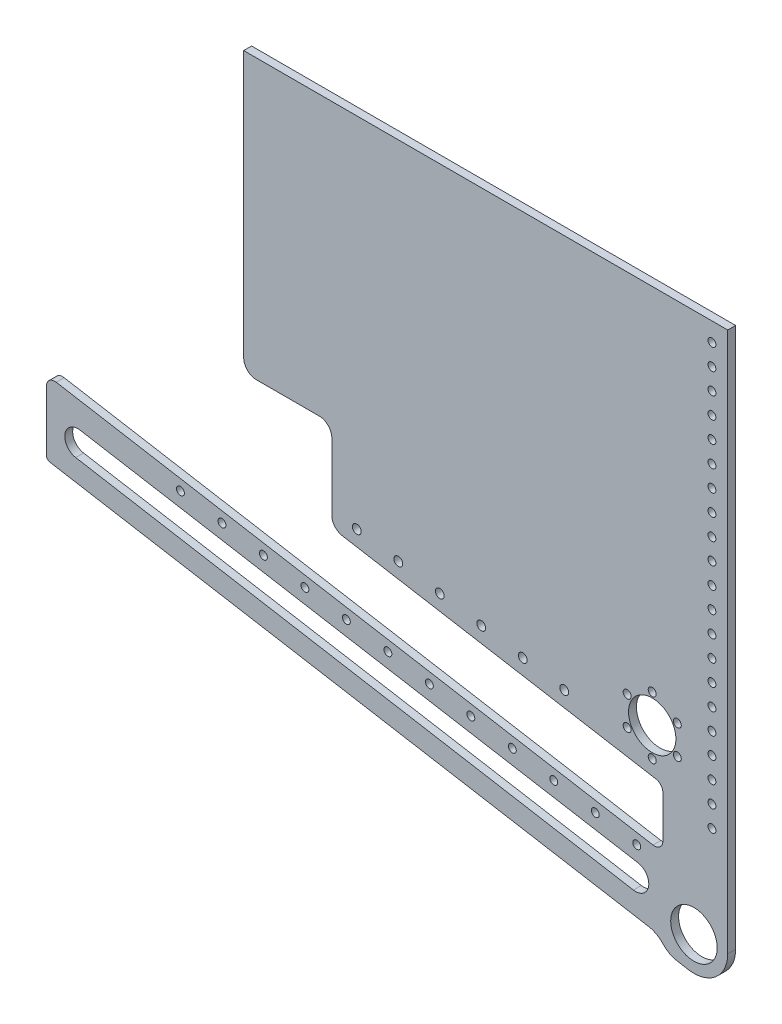
from build123d import *

# Parameters (mm, degrees)
SKETCH1_R           = 14.0335
SKETCH1_R_2         = 2.38125
SKETCH1_R_3         = 14.2875
SKETCH1_R_4         = 2.413
SKETCH1_R_5         = 2.667
BOSS_EXTRUDE1_DEPTH = 4.7625


with BuildPart() as part:
    # Sketch1 → Boss-Extrude1 (new body)
    with BuildSketch(Plane.XY):
        with BuildLine():
            Line((165.542350471, -12.850928795), (158.864493489, -11.70515089))
            ThreePointArc((158.864493489, -11.70515089), (154.154566121, -10.06953751), (150.224583517, -7.001332225))
            ThreePointArc((150.224583517, -7.001332225), (146.294597206, -3.933124046), (141.584665397, -2.297509122))
            Line((141.584665397, -2.297509122), (-219.697182678, 59.690754476))
            ThreePointArc((-219.697182678, 59.690754476), (-221.209634879, 60.557012384), (-221.807649529, 62.194172394))
            Line((-221.807649529, 62.194172394), (-221.807649529, 98.384220964))
            ThreePointArc((-221.807649529, 98.384220964), (-220.001969551, 102.268191663), (-215.868583232, 103.3910568))
            Line((-215.868583232, 103.3910568), (107.376757829, 47.929046973))
            Line((107.376757829, 47.929046973), (144.285517219, 41.596290654))
            ThreePointArc((144.285517219, 41.596290654), (148.418903539, 42.719155791), (150.224583517, 46.603126491))
            Line((150.224583517, 46.603126491), (150.224583517, 72.003126491))
            ThreePointArc((150.224583517, 72.003126491), (149.028554217, 75.277446512), (146.003649815, 77.009962327))
            Line((146.003649815, 77.009962327), (-43.218335812, 109.476421371))
            ThreePointArc((-43.218335812, 109.476421371), (-47.755692415, 112.075195094), (-49.549736366, 116.986675126))
            Line((-49.549736366, 116.986675126), (-49.549736366, 157.457180393))
            ThreePointArc((-49.549736366, 157.457180393), (-51.781582693, 162.845334066), (-57.169736366, 165.077180393))
            Line((-57.169736366, 165.077180393), (-95.10714601, 165.077180393))
            ThreePointArc((-95.10714601, 165.077180393), (-100.495299682, 167.309026721), (-102.72714601, 172.697180393))
            Line((-102.72714601, 172.697180393), (-102.72714601, 333.30748602))
            Line((-102.72714601, 333.30748602), (189.37285399, 333.30748602))
            Line((189.37285399, 333.30748602), (189.37285399, 131.560051298))
            Line((189.37285399, 131.560051298), (189.37285399, 7.239))
            ThreePointArc((189.37285399, 7.239), (182.127563077, -8.345432433), (165.542350471, -12.850928795))
        make_face()
        with Locations((168.98935399, 7.239)):
            Circle(SKETCH1_R, mode=Mode.SUBTRACT)
        with Locations((179.847857475, 118.860051298)):
            Circle(SKETCH1_R_2, mode=Mode.SUBTRACT)
        with Locations((179.847857475, 106.160051298)):
            Circle(SKETCH1_R_2, mode=Mode.SUBTRACT)
        with Locations((179.847857475, 93.460051298)):
            Circle(SKETCH1_R_2, mode=Mode.SUBTRACT)
        with Locations((179.847857475, 80.760051298)):
            Circle(SKETCH1_R_2, mode=Mode.SUBTRACT)
        with Locations((179.847857475, 68.060051298)):
            Circle(SKETCH1_R_2, mode=Mode.SUBTRACT)
        with Locations((109.44968796, 41.130584726)):
            Circle(SKETCH1_R_2, mode=Mode.SUBTRACT)
        with Locations((84.415508776, 45.425916214)):
            Circle(SKETCH1_R_2, mode=Mode.SUBTRACT)
        with Locations((59.381329592, 49.721247702)):
            Circle(SKETCH1_R_2, mode=Mode.SUBTRACT)
        with Locations((34.347150409, 54.016579191)):
            Circle(SKETCH1_R_2, mode=Mode.SUBTRACT)
        with Locations((9.312971225, 58.311910679)):
            Circle(SKETCH1_R_2, mode=Mode.SUBTRACT)
        with Locations((-15.721207959, 62.607242167)):
            Circle(SKETCH1_R_2, mode=Mode.SUBTRACT)
        with Locations((-40.755387143, 66.902573656)):
            Circle(SKETCH1_R_2, mode=Mode.SUBTRACT)
        with Locations((-65.789566327, 71.197905144)):
            Circle(SKETCH1_R_2, mode=Mode.SUBTRACT)
        with Locations((-90.82374551, 75.493236632)):
            Circle(SKETCH1_R_2, mode=Mode.SUBTRACT)
        with Locations((-115.857924694, 79.788568121)):
            Circle(SKETCH1_R_2, mode=Mode.SUBTRACT)
        with Locations((-140.892103878, 84.083899609)):
            Circle(SKETCH1_R_2, mode=Mode.SUBTRACT)
        with Locations((134.483867144, 36.835253237)):
            Circle(SKETCH1_R_2, mode=Mode.SUBTRACT)
        with Locations((143.80981943, 103.921008836)):
            Circle(SKETCH1_R_3, mode=Mode.SUBTRACT)
        with Locations((143.80981943, 121.383508836)):
            Circle(SKETCH1_R_4, mode=Mode.SUBTRACT)
        with Locations((158.932788044, 112.652258836)):
            Circle(SKETCH1_R_4, mode=Mode.SUBTRACT)
        with Locations((158.932788044, 95.189758836)):
            Circle(SKETCH1_R_4, mode=Mode.SUBTRACT)
        with Locations((143.80981943, 86.458508836)):
            Circle(SKETCH1_R_4, mode=Mode.SUBTRACT)
        with Locations((128.686850817, 95.189758836)):
            Circle(SKETCH1_R_4, mode=Mode.SUBTRACT)
        with Locations((128.686850817, 112.652258836)):
            Circle(SKETCH1_R_4, mode=Mode.SUBTRACT)
        with Locations((179.847857475, 131.560051298)):
            Circle(SKETCH1_R_2, mode=Mode.SUBTRACT)
        with Locations((179.847857475, 144.260051298)):
            Circle(SKETCH1_R_2, mode=Mode.SUBTRACT)
        with Locations((179.847857475, 156.960051298)):
            Circle(SKETCH1_R_2, mode=Mode.SUBTRACT)
        with Locations((179.847857475, 169.660051298)):
            Circle(SKETCH1_R_2, mode=Mode.SUBTRACT)
        with Locations((179.847857475, 182.360051298)):
            Circle(SKETCH1_R_2, mode=Mode.SUBTRACT)
        with Locations((179.847857475, 195.060051298)):
            Circle(SKETCH1_R_2, mode=Mode.SUBTRACT)
        with Locations((179.847857475, 207.760051298)):
            Circle(SKETCH1_R_2, mode=Mode.SUBTRACT)
        with Locations((179.847857475, 220.460051298)):
            Circle(SKETCH1_R_2, mode=Mode.SUBTRACT)
        with Locations((179.847857475, 233.160051298)):
            Circle(SKETCH1_R_2, mode=Mode.SUBTRACT)
        with Locations((179.847857475, 245.860051298)):
            Circle(SKETCH1_R_2, mode=Mode.SUBTRACT)
        with Locations((179.847857475, 258.560051298)):
            Circle(SKETCH1_R_2, mode=Mode.SUBTRACT)
        with Locations((179.847857475, 271.260051298)):
            Circle(SKETCH1_R_2, mode=Mode.SUBTRACT)
        with Locations((179.847857475, 283.960051298)):
            Circle(SKETCH1_R_2, mode=Mode.SUBTRACT)
        with Locations((179.847857475, 296.660051298)):
            Circle(SKETCH1_R_2, mode=Mode.SUBTRACT)
        with Locations((179.847857475, 309.360051298)):
            Circle(SKETCH1_R_2, mode=Mode.SUBTRACT)
        with Locations((179.847857475, 322.060051298)):
            Circle(SKETCH1_R_2, mode=Mode.SUBTRACT)
        with Locations((-9.432735227, 113.017786349)):
            Circle(SKETCH1_R_5, mode=Mode.SUBTRACT)
        with Locations((15.601656952, 108.723696433)):
            Circle(SKETCH1_R_5, mode=Mode.SUBTRACT)
        with Locations((40.636049132, 104.429606517)):
            Circle(SKETCH1_R_5, mode=Mode.SUBTRACT)
        with Locations((65.670441311, 100.135516602)):
            Circle(SKETCH1_R_5, mode=Mode.SUBTRACT)
        with Locations((90.704833491, 95.841426686)):
            Circle(SKETCH1_R_5, mode=Mode.SUBTRACT)
        with Locations((-34.467127407, 117.311876264)):
            Circle(SKETCH1_R_5, mode=Mode.SUBTRACT)
        with BuildLine():
            Line((132.450059381, 12.155377797), (-204.099940619, 69.90018348))
            ThreePointArc((-204.099940619, 69.90018348), (-210.580830524, 79.065655565), (-201.415358439, 85.54654547))
            Line((-201.415358439, 85.54654547), (135.134641561, 27.801739787))
            ThreePointArc((135.134641561, 27.801739787), (141.615531466, 18.636267702), (132.450059381, 12.155377797))
        make_face(mode=Mode.SUBTRACT)
    extrude(amount=BOSS_EXTRUDE1_DEPTH)


solid = part.part
